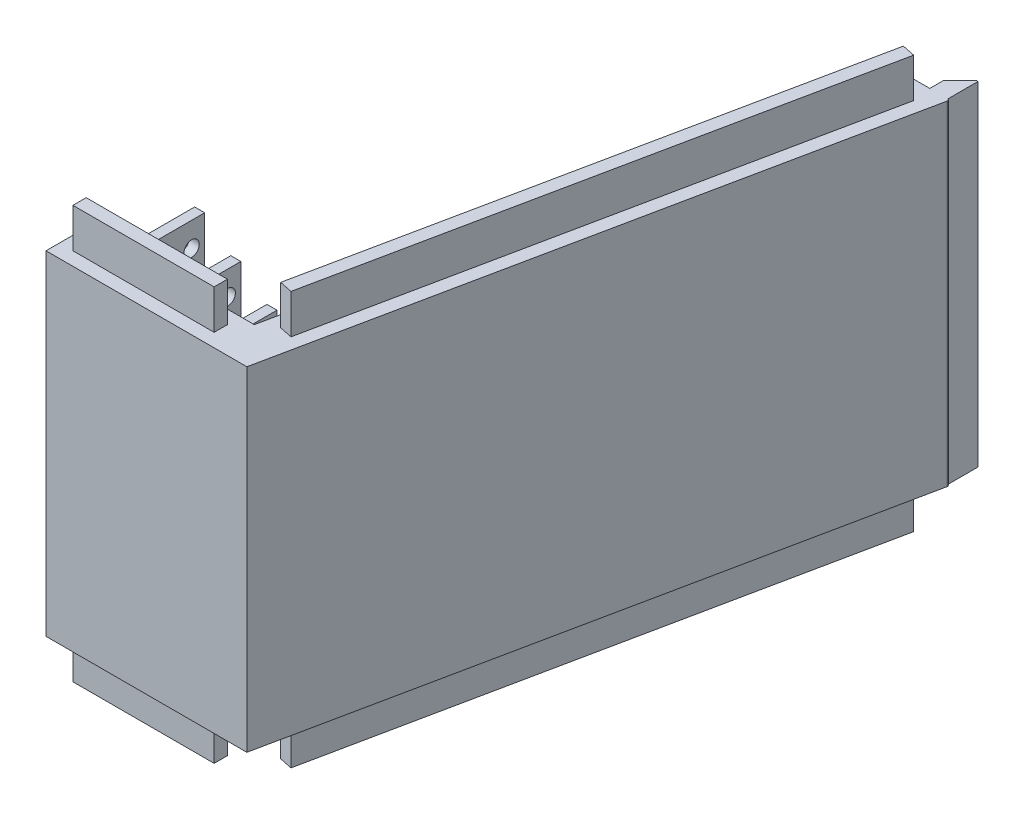
from build123d import *

# Parameters (mm, degrees)
BOSS_EXTRUDE1_DEPTH = 83.125
SKETCH2_W           = 35.157177314
SKETCH2_H           = 3.3
BOSS_EXTRUDE2_DEPTH = 9.8
SKETCH7_W           = 2.5
SKETCH7_H           = 10
BOSS_EXTRUDE4_DEPTH = 83.125
CUT_EXTRUDE5_REACH  = 186.424
SKETCH8_R           = 1.9
CUT_EXTRUDE6_REACH  = 191.835
SKETCH9_R           = 1.9
CUT_EXTRUDE9_REACH  = 182.103
SKETCH12_R          = 1.9
CUT_EXTRUDE7_REACH  = 191.835
SKETCH10_W          = 33.125
SKETCH10_H          = 22
SKETCH10_W_2        = 4.055
SKETCH11_W          = 53.125
SKETCH11_H          = 124.429937858
SKETCH11_H_2        = 13.429202889
CUT_EXTRUDE8_DEPTH  = 5
CHAMFER1_SIZE       = 4
FILLET1_R           = 0.5
CHAMFER2_SIZE       = 10
CHAMFER2_SIZE_2     = 5.773502692


with BuildPart() as part:
    # Sketch1 → Boss-Extrude1 (new body)
    with BuildSketch(Plane(origin=(0, 0, 0), x_dir=(-1, 0, 0), z_dir=(0, 1, 0))):
        Polygon((19.688093764, 147.570616058), (-10.311906236, 2.570616058), (-9.811906236, 2.570616058), (-9.811906236, -4.929383942), (-5.311906236, -4.929383942), (-5.311906236, 2.570616058), (-0.100118033, 2.570616058), (27.83091645, 137.570616058), (69.688093764, 137.570616058), (69.688093764, 147.570616058), align=None)
    extrude(amount=BOSS_EXTRUDE1_DEPTH)

    # Sketch2 → Boss-Extrude2 (add)
    with BuildSketch(Plane(origin=(0, 83.125, 0), x_dir=(-1, 0, 0), z_dir=(0, 1, 0))):
        Polygon((23.871665271, 134.968822427), (-2.701911664, 6.529867237), (-5.933471049, 7.198465731), (20.640105887, 135.63742092), align=None)
        with Locations((48.759505107, 142.570616058)):
            Rectangle(SKETCH2_W, SKETCH2_H)
    boss_extrude2 = extrude(amount=BOSS_EXTRUDE2_DEPTH)

    # Mirror1: Boss-Extrude2 across plane
    add(boss_extrude2.mirror(Plane.ZX.offset(41.5625)))

    # Sketch7 → Boss-Extrude4 (add)
    with BuildSketch(Plane(origin=(0, 83.125, 0), x_dir=(-1, 0, 0), z_dir=(0, 1, 0))):
        Polygon((64.688093764, 137.570616058), (47.188093764, 137.570616058), (47.188093764, 121.570616058), (49.688093764, 121.570616058), (49.688093764, 132.570616058), (62.188093764, 132.570616058), (62.188093764, 115.570616058), (64.688093764, 115.570616058), align=None)
        with Locations((33.438093764, 132.570616058)):
            Rectangle(SKETCH7_W, SKETCH7_H)
    extrude(amount=-BOSS_EXTRUDE4_DEPTH)

    # Sketch8 → Cut-Extrude5 (cut, up to next)
    with BuildSketch(Plane(origin=(-49.688093764, 0, 0), x_dir=(0, -1, 0), z_dir=(-1, 0, 0)), mode=Mode.PRIVATE) as cut_extrude5_sk1:
        with Locations(Location((-72.9725, 124.820616058, 0), (0, 0, 90))):
            Circle(SKETCH8_R)
    cut_extrude5_tool1 = extrude(cut_extrude5_sk1.sketch, amount=-CUT_EXTRUDE5_REACH, mode=Mode.PRIVATE) & part.part
    # Sketch8 → Cut-Extrude5 (cut, up to next)
    with BuildSketch(Plane(origin=(-49.688093764, 0, 0), x_dir=(0, -1, 0), z_dir=(-1, 0, 0)), mode=Mode.PRIVATE) as cut_extrude5_sk2:
        with Locations(Location((-10.1525, 124.820616058, 0), (0, 0, 90))):
            Circle(SKETCH8_R)
    cut_extrude5_tool2 = extrude(cut_extrude5_sk2.sketch, amount=-CUT_EXTRUDE5_REACH, mode=Mode.PRIVATE) & part.part
    add(cut_extrude5_tool1.solids().sort_by_distance((-49.688094, 72.9725, 124.820616))[0], mode=Mode.SUBTRACT)
    add(cut_extrude5_tool2.solids().sort_by_distance((-49.688094, 10.1525, 124.820616))[0], mode=Mode.SUBTRACT)

    # Sketch9 → Cut-Extrude6 (cut, up to next)
    with BuildSketch(Plane(origin=(-64.688093764, 0, 0), x_dir=(0, -1, 0), z_dir=(-1, 0, 0)), mode=Mode.PRIVATE) as cut_extrude6_sk1:
        with Locations(Location((-72.9725, 118.820616058, 0), (0, 0, 90))):
            Circle(SKETCH9_R)
    cut_extrude6_tool1 = extrude(cut_extrude6_sk1.sketch, amount=-CUT_EXTRUDE6_REACH, mode=Mode.PRIVATE) & part.part
    # Sketch9 → Cut-Extrude6 (cut, up to next)
    with BuildSketch(Plane(origin=(-64.688093764, 0, 0), x_dir=(0, -1, 0), z_dir=(-1, 0, 0)), mode=Mode.PRIVATE) as cut_extrude6_sk2:
        with Locations(Location((-18.9025, 118.820616058, 0), (0, 0, 90))):
            Circle(SKETCH9_R)
    cut_extrude6_tool2 = extrude(cut_extrude6_sk2.sketch, amount=-CUT_EXTRUDE6_REACH, mode=Mode.PRIVATE) & part.part
    # Sketch9 → Cut-Extrude6 (cut, up to next)
    with BuildSketch(Plane(origin=(-64.688093764, 0, 0), x_dir=(0, -1, 0), z_dir=(-1, 0, 0)), mode=Mode.PRIVATE) as cut_extrude6_sk3:
        with Locations(Location((-10.1525, 118.820616058, 0), (0, 0, 90))):
            Circle(SKETCH9_R)
    cut_extrude6_tool3 = extrude(cut_extrude6_sk3.sketch, amount=-CUT_EXTRUDE6_REACH, mode=Mode.PRIVATE) & part.part
    # Sketch9 → Cut-Extrude6 (cut, up to next)
    with BuildSketch(Plane(origin=(-64.688093764, 0, 0), x_dir=(0, -1, 0), z_dir=(-1, 0, 0)), mode=Mode.PRIVATE) as cut_extrude6_sk4:
        with Locations(Location((-64.2225, 118.820616058, 0), (0, 0, 90))):
            Circle(SKETCH9_R)
    cut_extrude6_tool4 = extrude(cut_extrude6_sk4.sketch, amount=-CUT_EXTRUDE6_REACH, mode=Mode.PRIVATE) & part.part
    add(cut_extrude6_tool1.solids().sort_by_distance((-64.688094, 72.9725, 118.820616))[0], mode=Mode.SUBTRACT)
    add(cut_extrude6_tool2.solids().sort_by_distance((-64.688094, 18.9025, 118.820616))[0], mode=Mode.SUBTRACT)
    add(cut_extrude6_tool3.solids().sort_by_distance((-64.688094, 10.1525, 118.820616))[0], mode=Mode.SUBTRACT)
    add(cut_extrude6_tool4.solids().sort_by_distance((-64.688094, 64.2225, 118.820616))[0], mode=Mode.SUBTRACT)

    # Sketch12 → Cut-Extrude9 (cut, up to next)
    with BuildSketch(Plane(origin=(-34.688093764, 0, 0), x_dir=(0, -1, 0), z_dir=(-1, 0, 0)), mode=Mode.PRIVATE) as cut_extrude9_sk1:
        with Locations(Location((-72.9725, 130.751875225, 0), (0, 0, 90))):
            Circle(SKETCH12_R)
    cut_extrude9_tool1 = extrude(cut_extrude9_sk1.sketch, amount=-CUT_EXTRUDE9_REACH, mode=Mode.PRIVATE) & part.part
    # Sketch12 → Cut-Extrude9 (cut, up to next)
    with BuildSketch(Plane(origin=(-34.688093764, 0, 0), x_dir=(0, -1, 0), z_dir=(-1, 0, 0)), mode=Mode.PRIVATE) as cut_extrude9_sk2:
        with Locations(Location((-10.1525, 130.751875225, 0), (0, 0, 90))):
            Circle(SKETCH12_R)
    cut_extrude9_tool2 = extrude(cut_extrude9_sk2.sketch, amount=-CUT_EXTRUDE9_REACH, mode=Mode.PRIVATE) & part.part
    add(cut_extrude9_tool1.solids().sort_by_distance((-34.688094, 72.9725, 130.751875))[0], mode=Mode.SUBTRACT)
    add(cut_extrude9_tool2.solids().sort_by_distance((-34.688094, 10.1525, 130.751875))[0], mode=Mode.SUBTRACT)

    # Cut-Extrude7: up to this face of the body (flat: up to its plane)
    cut_extrude7_end = Plane(part.part.faces().sort_by_distance((-32.188093764, 41.5625, 132.621636181))[0])
    # Sketch10 → Cut-Extrude7 (cut, up to the picked face)
    with BuildSketch(Plane(origin=(-64.688093764, 0, 0), x_dir=(0, -1, 0), z_dir=(-1, 0, 0)), mode=Mode.PRIVATE) as cut_extrude7_sk1:
        with Locations((-41.5625, 126.570616058)):
            Rectangle(SKETCH10_W, SKETCH10_H)
    cut_extrude7_tool1 = split(extrude(cut_extrude7_sk1.sketch, amount=-CUT_EXTRUDE7_REACH, mode=Mode.PRIVATE), bisect_by=cut_extrude7_end, keep=Keep.BOTH, mode=Mode.PRIVATE)
    # Sketch10 → Cut-Extrude7 (cut, up to the picked face)
    with BuildSketch(Plane(origin=(-64.688093764, 0, 0), x_dir=(0, -1, 0), z_dir=(-1, 0, 0)), mode=Mode.PRIVATE) as cut_extrude7_sk2:
        with Locations((-81.0975, 126.570616058)):
            Rectangle(SKETCH10_W_2, SKETCH10_H)
    cut_extrude7_tool2 = split(extrude(cut_extrude7_sk2.sketch, amount=-CUT_EXTRUDE7_REACH, mode=Mode.PRIVATE), bisect_by=cut_extrude7_end, keep=Keep.BOTH, mode=Mode.PRIVATE)
    # Sketch10 → Cut-Extrude7 (cut, up to the picked face)
    with BuildSketch(Plane(origin=(-64.688093764, 0, 0), x_dir=(0, -1, 0), z_dir=(-1, 0, 0)), mode=Mode.PRIVATE) as cut_extrude7_sk3:
        with Locations((-2.0275, 126.570616058)):
            Rectangle(SKETCH10_W_2, SKETCH10_H)
    cut_extrude7_tool3 = split(extrude(cut_extrude7_sk3.sketch, amount=-CUT_EXTRUDE7_REACH, mode=Mode.PRIVATE), bisect_by=cut_extrude7_end, keep=Keep.BOTH, mode=Mode.PRIVATE)
    add(cut_extrude7_tool1.solids().sort_by(Axis((-64.688094, 41.5625, 126.570616), (1, 0, 0)))[0], mode=Mode.SUBTRACT)
    add(cut_extrude7_tool2.solids().sort_by(Axis((-64.688094, 81.0975, 126.570616), (1, 0, 0)))[0], mode=Mode.SUBTRACT)
    add(cut_extrude7_tool3.solids().sort_by(Axis((-64.688094, 2.0275, 126.570616), (1, 0, 0)))[0], mode=Mode.SUBTRACT)

    # Sketch11 → Cut-Extrude8 (cut)
    with BuildSketch(Plane(origin=(0.60602789, 0, 0.125385081), x_dir=(0, -1, 0), z_dir=(-0.9792604195071029, 0, -0.20260560403595218))):
        with Locations((-41.5625, 78.141189903)):
            Rectangle(SKETCH11_W, SKETCH11_H)
        with Locations((-41.5625, 9.21161953)):
            Rectangle(SKETCH11_W, SKETCH11_H_2)
    extrude(amount=-CUT_EXTRUDE8_DEPTH, mode=Mode.SUBTRACT)

    # Chamfer1
    chamfer1_edges = [part.edges().sort_by_distance(p)[0] for p in [
        (5.311906236, 41.5625, -4.929383942),
    ]]
    chamfer(chamfer1_edges, length=CHAMFER1_SIZE)

    # Fillet1
    # the kernel refuses this fillet: 0.5 mm, written as the material it takes off along each edge
    with BuildSketch(Plane(origin=(10.311906236, -1.502988145, 2.570616058), x_dir=(-1, 0, 0), z_dir=(0, 1, 0))) as fillet1_piece_1:
        with BuildLine():
            CenterArc((0.611435738, 0.487423918), FILLET1_R, 168.310630825, 88.811624366)
            Line((0.121805528, 0.58872672), (0.112012924, 0.590752776))
            Line((0.112012924, 0.590752776), (-0.009792604, 0.002026056))
            Line((-0.009792604, 0.002026056), (0, -0.01))
            ThreePointArc((0, -0.01), (0.25, -0.01), (0.497771285, -0.009748478))
            Line((0.497771285, -0.009748478), (0.5, 0))
        make_face()
    extrude(amount=86.13097629, mode=Mode.SUBTRACT)

    # Chamfer2
    # the kernel refuses this chamfer: 10, 5.773502692 mm, written as the material it takes off along each edge
    with BuildSketch(Plane(origin=(0.100118033, 68.125, 2.570616058), x_dir=(-0.018925936601608705, 0.9998132206222079, -0.003915711021022488), z_dir=(-0.20260560403595218, 0, 0.9792604195071029))) as chamfer2_piece_1_section:
        Polygon((CHAMFER2_SIZE * 0.999813220622, -CHAMFER2_SIZE * 0.0193267656127), (-CHAMFER2_SIZE_2 * 0.0193267656124, -CHAMFER2_SIZE_2 * 0.999813220604), (0, 0), align=None)
    chamfer2_piece_1 = extrude(amount=137.859140746, mode=Mode.PRIVATE)
    chamfer2_piece_1 = split(chamfer2_piece_1, bisect_by=Plane(origin=(4.844173208, 72.725966315, 4.319504201), z_dir=(-0.9792604195071029, 0, -0.20260560403595218)), keep=Keep.TOP, mode=Mode.PRIVATE)
    add(chamfer2_piece_1, mode=Mode.SUBTRACT)
    with BuildSketch(Plane(origin=(0.100118033, 15, 2.570616058), x_dir=(-0.01892593660160869, -0.9998132206222079, -0.0039157110210224855), z_dir=(-0.20260560403595218, 0, 0.9792604195071029))) as chamfer2_piece_2_section:
        Polygon((CHAMFER2_SIZE * 0.999813220622, CHAMFER2_SIZE * 0.0193267656127), (-CHAMFER2_SIZE_2 * 0.0193267656124, CHAMFER2_SIZE_2 * 0.999813220604), (0, 0), align=None)
    chamfer2_piece_2 = extrude(amount=137.859140746, mode=Mode.PRIVATE)
    chamfer2_piece_2 = split(chamfer2_piece_2, bisect_by=Plane(origin=(4.844173208, 10.399033685, 4.319504201), z_dir=(-0.9792604195071029, 0, -0.20260560403595218)), keep=Keep.TOP, mode=Mode.PRIVATE)
    add(chamfer2_piece_2, mode=Mode.SUBTRACT)


solid = part.part
